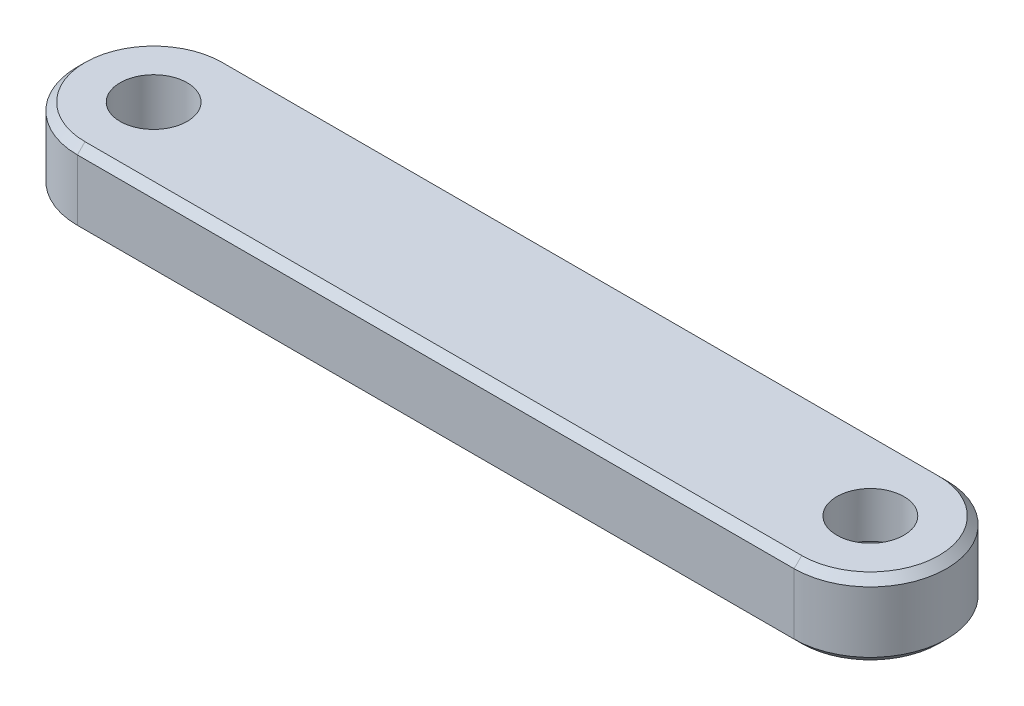
from build123d import *

# Parameters (mm, degrees)
EXTRUDE_START       = -0.0001
EXTRUDE_2_OUTLINE_R = 2.2
EXTRUDE_2_DEPTH     = 5.0001
SKETCH_3_R          = 3.5
SKETCH_3_R_2        = 2.2
CUT_EXTRUDE_1_DEPTH = 2
CHAMFER_1_SIZE      = 0.5


# Read off the part's stored shape, not the designer's step: 凸台-拉伸2
with BuildPart() as part:
    # 凸台-拉伸2 outline → 凸台-拉伸2 (new body)
    with BuildSketch(Plane(origin=(0, 0, 0), x_dir=(1, 0, 0), z_dir=(0, 1, 0)).offset(EXTRUDE_START)):
        with BuildLine():
            Line((47, 5), (0, 5))
            ThreePointArc((0, 5), (-5, 0), (0, -5))
            Line((0, -5), (47, -5))
            ThreePointArc((47, -5), (52, 0), (47, 5))
        make_face()
        Circle(EXTRUDE_2_OUTLINE_R, mode=Mode.SUBTRACT)
        with Locations((47, 0)):
            Circle(EXTRUDE_2_OUTLINE_R, mode=Mode.SUBTRACT)
    extrude(amount=EXTRUDE_2_DEPTH)

    # 草图3 → 切除-拉伸1 (cut)
    with BuildSketch(Plane.XZ.offset(0.0001)):
        with Locations(Location((47, 0, 0), (0, 0, 270))):
            Circle(SKETCH_3_R)
        with Locations(Location((47, 0, 0), (0, 0, 90))):
            Circle(SKETCH_3_R_2, mode=Mode.SUBTRACT)
    extrude(amount=-CUT_EXTRUDE_1_DEPTH, mode=Mode.SUBTRACT)

    # 倒角1
    chamfer_1_edges = [part.edges().sort_by_distance(p)[0] for p in [
        (52, -0.0001, 0),
        (23.5, -0.0001, -5),
        (-5, 5, 0),
        (23.5, 5, 5),
        (52, 5, 0),
        (23.5, 5, -5),
        (47, -0.0001, 3.5),
        (-5, -0.0001, 0),
        (23.5, -0.0001, 5),
    ]]
    chamfer(chamfer_1_edges, length=CHAMFER_1_SIZE)


solid = part.part
